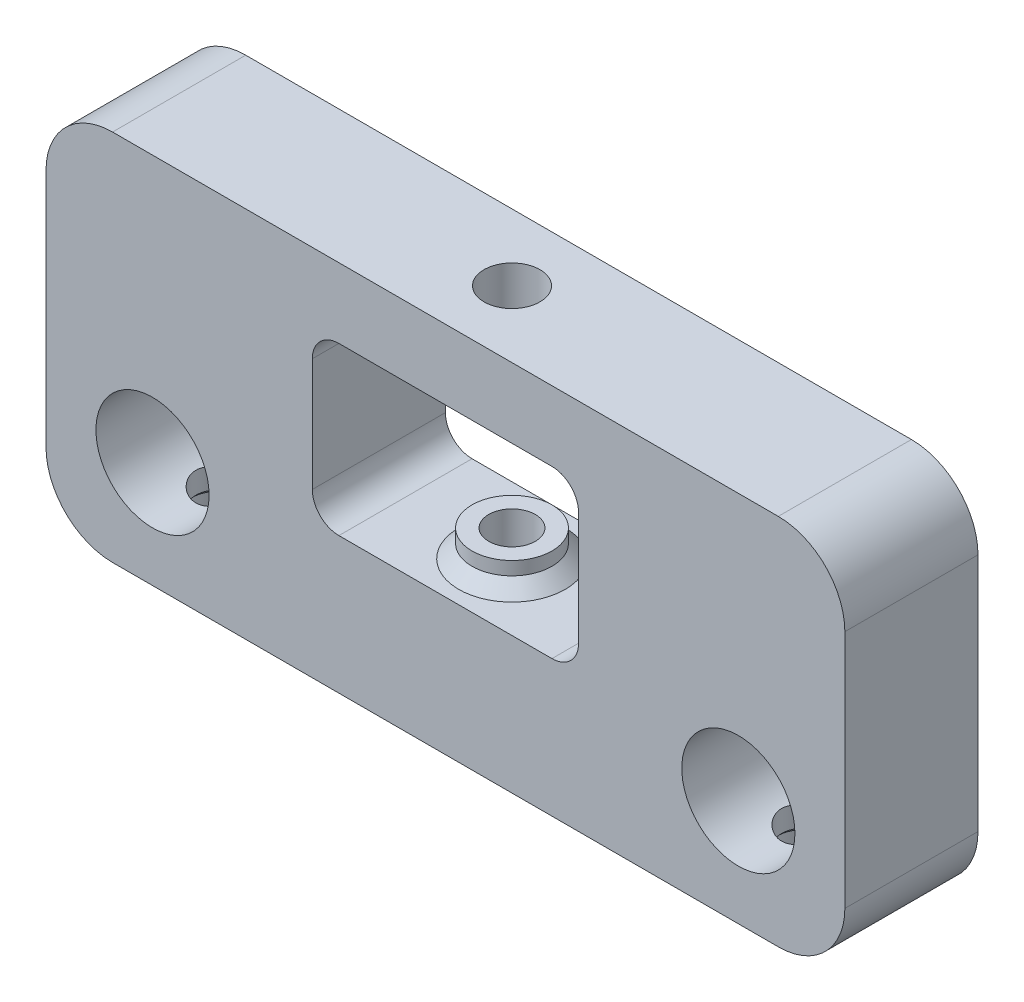
from build123d import *
from build123d.topology import SkipClean

# Parameters (mm, degrees)
SKETCH1_W           = 60
SKETCH1_H           = 28
SKETCH1_R           = 4.25
BOSS_EXTRUDE1_DEPTH = 5
SKETCH2_W           = 20
SKETCH2_H           = 12.5
CUT_EXTRUDE1_DEPTH  = 35.583232932
SKETCH3_R           = 1.75
CUT_EXTRUDE2_DEPTH  = 30
CUT_EXTRUDE3_REACH  = 43.34
SKETCH4_R           = 1.75
FILLET1_R           = 5
FILLET2_R           = 2
SKETCH5_R           = 3.25
CUT_EXTRUDE4_DEPTH  = 4
SKETCH6_R           = 2.1
CUT_EXTRUDE5_DEPTH  = 2
SKETCH7_R           = 3
SKETCH7_R_2         = 1.75
BOSS_EXTRUDE2_DEPTH = 2
BOSS_EXTRUDE3_START = 2
SKETCH8_R           = 3
SKETCH8_R_2         = 1.75
BOSS_EXTRUDE3_DEPTH = 2
SKETCH9_R           = 2.1
CUT_EXTRUDE6_DEPTH  = 3
CHAMFER1_SIZE       = 0.5
CHAMFER2_SIZE       = 1


with BuildPart() as part:
    # Sketch1 → Boss-Extrude1 (new, symmetric)
    with BuildSketch(Plane.XY):
        Rectangle(SKETCH1_W, SKETCH1_H)
        with Locations((-22, -6)):
            Circle(SKETCH1_R, mode=Mode.SUBTRACT)
        with Locations((22, -6)):
            Circle(SKETCH1_R, mode=Mode.SUBTRACT)
    extrude(amount=BOSS_EXTRUDE1_DEPTH, both=True)

    # Sketch2 → Cut-Extrude1 (cut, through all)
    with BuildSketch(Plane(origin=(0, 0, -5), x_dir=(-1, 0, 0), z_dir=(0, 0, -1))):
        with Locations((0, 2.5)):
            Rectangle(SKETCH2_W, SKETCH2_H)
    extrude(amount=-CUT_EXTRUDE1_DEPTH, mode=Mode.SUBTRACT)

    # Sketch3 → Cut-Extrude2 (cut)
    with BuildSketch(Plane(origin=(0, 14, 0), x_dir=(1, 0, 0), z_dir=(0, 1, 0))):
        with Locations(Location((0, 0, 0), (0, 0, 270))):
            Circle(SKETCH3_R)
    extrude(amount=-CUT_EXTRUDE2_DEPTH, mode=Mode.SUBTRACT)

    # Sketch4 → Cut-Extrude3 (cut, up to next)
    with BuildSketch(Plane(origin=(0, -14, 0), x_dir=(1, 0, 0), z_dir=(0, 1, 0)), mode=Mode.PRIVATE) as cut_extrude3_sk1:
        with Locations(Location((-22, 0, 0), (0, 0, 90))):
            Circle(SKETCH4_R)
    cut_extrude3_tool1 = extrude(cut_extrude3_sk1.sketch, amount=CUT_EXTRUDE3_REACH, mode=Mode.PRIVATE) & part.part
    # Sketch4 → Cut-Extrude3 (cut, up to next)
    with BuildSketch(Plane(origin=(0, -14, 0), x_dir=(1, 0, 0), z_dir=(0, 1, 0)), mode=Mode.PRIVATE) as cut_extrude3_sk2:
        with Locations(Location((22, 0, 0), (0, 0, 90))):
            Circle(SKETCH4_R)
    cut_extrude3_tool2 = extrude(cut_extrude3_sk2.sketch, amount=CUT_EXTRUDE3_REACH, mode=Mode.PRIVATE) & part.part
    add(cut_extrude3_tool1.solids().sort_by_distance((-22, -14, 0))[0], mode=Mode.SUBTRACT)
    add(cut_extrude3_tool2.solids().sort_by_distance((22, -14, 0))[0], mode=Mode.SUBTRACT)

    # Fillet1
    fillet1_edges = [part.edges().sort_by_distance(p)[0] for p in [
        (-30, 14, 0),
        (30, 14, 0),
        (30, -14, 0),
        (-30, -14, 0),
    ]]
    fillet(fillet1_edges, radius=FILLET1_R)

    # Fillet2
    fillet2_edges = [part.edges().sort_by_distance(p)[0] for p in [
        (-10, 8.75, 0),
        (-10, -3.75, 0),
        (10, -3.75, 0),
        (10, 8.75, 0),
    ]]
    fillet(fillet2_edges, radius=FILLET2_R)

    # Sketch5 → Cut-Extrude4 (cut)
    with BuildSketch(Plane.XZ.offset(14)):
        with Locations(Location((0, 0, 0), (0, 0, 270))):
            Circle(SKETCH5_R)
    extrude(amount=-CUT_EXTRUDE4_DEPTH, mode=Mode.SUBTRACT)

    # Sketch6 → Cut-Extrude5 (cut)
    with BuildSketch(Plane(origin=(0, -14, 0), x_dir=(1, 0, 0), z_dir=(0, 1, 0))):
        with Locations(Location((-22, 0, 0), (0, 0, 270))):
            Circle(SKETCH6_R)
        with Locations(Location((22, 0, 0), (0, 0, 270))):
            Circle(SKETCH6_R)
    extrude(amount=CUT_EXTRUDE5_DEPTH, mode=Mode.SUBTRACT)

    # Sketch7 → Boss-Extrude2 (add)
    with SkipClean():  # the faces are left unmerged after this step: merging them gives an invalid solid
        with BuildSketch(Plane.XZ.offset(-8.75)):
            with Locations(Location((0, 0, 0), (0, 0, 180))):
                Circle(SKETCH7_R)
            Circle(SKETCH7_R_2, mode=Mode.SUBTRACT)
        extrude(amount=BOSS_EXTRUDE2_DEPTH)

    # Sketch8 → Boss-Extrude3 (add)
    with SkipClean():  # the faces are left unmerged after this step: merging them gives an invalid solid
        with BuildSketch(Plane(origin=(0, -3.75, 0), x_dir=(1, 0, 0), z_dir=(0, 1, 0)).offset(BOSS_EXTRUDE3_START)):
            with Locations(Location((0, 0, 0), (0, 0, 180))):
                Circle(SKETCH8_R)
            with Locations(Location((0, 0, 0), (0, 0, 180))):
                Circle(SKETCH8_R_2, mode=Mode.SUBTRACT)
        extrude(amount=-BOSS_EXTRUDE3_DEPTH)

    # Sketch9 → Cut-Extrude6 (cut)
    with SkipClean():  # the faces are left unmerged after this step: merging them gives an invalid solid
        with BuildSketch(Plane(origin=(0, 14, 0), x_dir=(1, 0, 0), z_dir=(0, 1, 0))):
            with Locations(Location((0, 0, 0), (0, 0, 270))):
                Circle(SKETCH9_R)
        extrude(amount=-CUT_EXTRUDE6_DEPTH, mode=Mode.SUBTRACT)

    # Chamfer1
    # the kernel refuses this chamfer: 0.5 mm, written as the material it takes off along each edge
    with BuildSketch(Plane(origin=(22, -12, 0), x_dir=(0, 0, -1), z_dir=(-1, 0, 0))) as chamfer1_piece_1_section:
        Polygon((1.75, -CHAMFER1_SIZE), (1.75 + CHAMFER1_SIZE, 0), (1.75, 0), align=None)
    chamfer1_piece_1 = revolve(axis=Axis((22, -12, 0), (0, -1, 0)), mode=Mode.PRIVATE)
    chamfer1_piece_1 = chamfer1_piece_1 & Plane(origin=(22, -11.675956313, 0), x_dir=(0, 0, 1), z_dir=(0, -1, 0)) * Cylinder(2.1, 9, mode=Mode.PRIVATE)
    add(chamfer1_piece_1, mode=Mode.SUBTRACT)
    with BuildSketch(Plane(origin=(-22, -12, 0), x_dir=(0, 0, -1), z_dir=(-1, 0, 0))) as chamfer1_piece_2_section:
        Polygon((1.75, -CHAMFER1_SIZE), (1.75 + CHAMFER1_SIZE, 0), (1.75, 0), align=None)
    chamfer1_piece_2 = revolve(axis=Axis((-22, -12, 0), (0, -1, 0)), mode=Mode.PRIVATE)
    chamfer1_piece_2 = chamfer1_piece_2 & Plane(origin=(-22, -11.675956313, 0), x_dir=(0, 0, 1), z_dir=(0, -1, 0)) * Cylinder(2.1, 9, mode=Mode.PRIVATE)
    add(chamfer1_piece_2, mode=Mode.SUBTRACT)
    with BuildSketch(Plane(origin=(0, 11, 0), x_dir=(0, 0, 1), z_dir=(-1, 0, 0))) as chamfer1_piece_3_section:
        Polygon((1.75 + CHAMFER1_SIZE, 0), (1.75, -CHAMFER1_SIZE), (1.75, 0), align=None)
    chamfer1_piece_3 = revolve(axis=Axis((0, 11, 0), (0, 1, 0)), mode=Mode.PRIVATE)
    chamfer1_piece_3 = chamfer1_piece_3 & Plane(origin=(0, 10.675956313, 0), x_dir=(0, 0, 1), z_dir=(0, 1, 0)) * Cylinder(2.1, 9, mode=Mode.PRIVATE)
    add(chamfer1_piece_3, mode=Mode.SUBTRACT)

    # Chamfer2
    chamfer2_edges = [part.edges().sort_by_distance(p)[0] for p in [
        (3, 8.75, 0),
        (3, -3.75, 0),
    ]]
    chamfer(chamfer2_edges, length=CHAMFER2_SIZE)


solid = part.part
